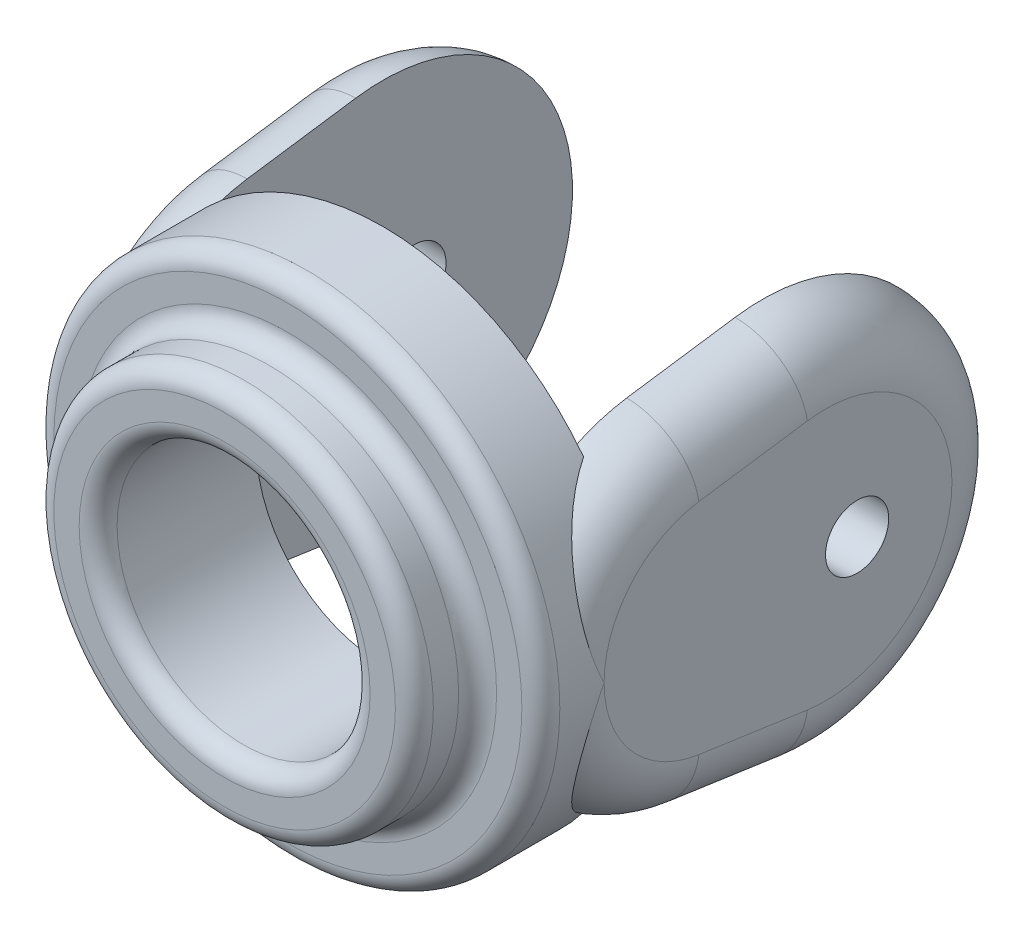
from build123d import *

# Parameters (mm, degrees)
EXTRUDE_1_DEPTH          = 10
EXTRUDE_1_DEPTH_BACK     = 5
SKETCH_1_R               = 40
SKETCH_2_R               = 30
EXTRUDE_2_DEPTH          = 10
SKETCH_3_R               = 20
CUT_EXTRUDE_1_DEPTH      = 62.846584384
EXTRUDE_3_DEPTH          = 10
EXTRUDE_START            = 10
EXTRUDE_4_DEPTH          = 10
CUT_EXTRUDE_2_DEPTH      = 111.566722046
CUT_EXTRUDE_2_DEPTH_BACK = 111.566722046
SKETCH_8_R               = 5
FILLET_1_R               = 10
FILLET_2_R               = 10
FILLET_3_R               = 3
FILLET_4_R               = 3


with BuildPart() as part:
    # 스케치1 → 보스-돌출1 (new, two sides: drawn at the far end of the back side and taken through both)
    with BuildSketch(Plane.XY.offset(-EXTRUDE_1_DEPTH_BACK)):
        Circle(SKETCH_1_R)
    extrude(amount=EXTRUDE_1_DEPTH + EXTRUDE_1_DEPTH_BACK)

    # 스케치2 → 보스-돌출2 (add)
    with BuildSketch(Plane.XY.offset(10)):
        Circle(SKETCH_2_R)
    extrude(amount=EXTRUDE_2_DEPTH)

    # 스케치3 → 컷-돌출1 (cut, through all)
    with BuildSketch(Plane.XY.offset(20)):
        Circle(SKETCH_3_R)
    extrude(amount=-CUT_EXTRUDE_1_DEPTH, mode=Mode.SUBTRACT)

    # 스케치6 → 보스-돌출3 (add)
    with BuildSketch(Plane(origin=(40, 0, 0), x_dir=(0, 0, -1), z_dir=(1, 0, 0))):
        with BuildLine():
            Line((13.571428571, 27.217941262), (30.714285714, 29.692299558))
            ThreePointArc((30.714285714, 29.692299558), (65, 0), (30.714285714, -29.692299558))
            Line((30.714285714, -29.692299558), (13.571428571, -27.217941262))
            ThreePointArc((13.571428571, -27.217941262), (-10, 0), (13.571428571, 27.217941262))
        make_face()
    extrude(amount=-EXTRUDE_3_DEPTH)

    # 스케치7 → 보스-돌출4 (add)
    with BuildSketch(Plane(origin=(-40, 0, 0), x_dir=(0, 0, -1), z_dir=(1, 0, 0)).offset(EXTRUDE_START)):
        with BuildLine():
            Line((30.714285714, 29.692299558), (13.571428571, 27.217941262))
            ThreePointArc((13.571428571, 27.217941262), (-10, 0), (13.571428571, -27.217941262))
            Line((13.571428571, -27.217941262), (30.714285714, -29.692299558))
            ThreePointArc((30.714285714, -29.692299558), (65, 0), (30.714285714, 29.692299558))
        make_face()
    extrude(amount=-EXTRUDE_4_DEPTH)

    # 스케치8 → 컷-돌출2 (cut, two sides: drawn at the far end of the back side and taken through both)
    with BuildSketch(Plane(origin=(-40, 0, 0), x_dir=(0, 0, -1), z_dir=(1, 0, 0)).offset(-CUT_EXTRUDE_2_DEPTH_BACK)):
        with Locations((40, 0)):
            Circle(SKETCH_8_R)
    extrude(amount=CUT_EXTRUDE_2_DEPTH + CUT_EXTRUDE_2_DEPTH_BACK, mode=Mode.SUBTRACT)

    # 필렛1
    # the kernel refuses this fillet: 10 mm, written as the material it takes off along each edge
    with BuildSketch(Plane(origin=(40, 0, -35), x_dir=(0, 0.989743318610787, 0.14285714285714288), z_dir=(0, -0.14285714285714288, 0.989743318610787))) as fillet_1_piece_1:
        with BuildLine():
            CenterArc((30 - FILLET_1_R, FILLET_1_R), FILLET_1_R, 270, 90)
            Line((30, FILLET_1_R), (30, 0))
            Line((30, 0), (30 - FILLET_1_R, 0))
        make_face()
    revolve(axis=Axis((40, 0, -35), (-1, 0, 0)), revolution_arc=196.426421403, mode=Mode.SUBTRACT)
    with BuildSketch(Plane(origin=(40, 27.217941262, -13.571428571), x_dir=(0, -0.9897433186107871, -0.1428571428571427), z_dir=(0, 0.1428571428571427, -0.9897433186107871)), Plane(origin=(40, -29.692299558, -30.714285714), x_dir=(0, 0.9897433186107871, -0.1428571428571427), z_dir=(0, 0.1428571428571427, 0.9897433186107871))) as fillet_1_piece_2:
        with BuildLine():
            CenterArc((FILLET_1_R, FILLET_1_R), FILLET_1_R, 180, 90)
            Line((0, FILLET_1_R), (0, 0))
            Line((0, 0), (FILLET_1_R, 0))
        make_face()
    extrude(amount=17.320508076, mode=Mode.SUBTRACT)
    with BuildSketch(Plane(origin=(40, 0, -17.5), x_dir=(0, -0.9897433186107871, 0.14285714285714243), z_dir=(0, -0.14285714285714243, -0.9897433186107871))) as fillet_1_piece_3_section:
        with BuildLine():
            CenterArc((27.5 - FILLET_1_R, FILLET_1_R), FILLET_1_R, 270, 90)
            Line((27.5 - FILLET_1_R, 0), (27.5, 0))
            Line((27.5, 0), (27.5, FILLET_1_R))
        make_face()
    fillet_1_piece_3 = revolve(axis=Axis((40, 0, -17.5), (-1, 0, 0)), revolution_arc=81.786789298, mode=Mode.PRIVATE)
    fillet_1_piece_3 = split(fillet_1_piece_3, bisect_by=Plane(origin=(37.813701487, -23.668076626, -5), z_dir=(0, 0, -1)), keep=Keep.TOP, mode=Mode.PRIVATE)
    add(fillet_1_piece_3, mode=Mode.SUBTRACT)
    with BuildSketch(Plane(origin=(40, 0, -17.5), x_dir=(0, -0.9897433186107871, 0.14285714285714243), z_dir=(0, -0.14285714285714243, -0.9897433186107871))) as fillet_1_piece_4_section:
        with BuildLine():
            CenterArc((27.5 - FILLET_1_R, FILLET_1_R), FILLET_1_R, 270, 90)
            Line((27.5 - FILLET_1_R, 0), (27.5, 0))
            Line((27.5, 0), (27.5, FILLET_1_R))
        make_face()
    fillet_1_piece_4 = revolve(axis=Axis((40, 0, -17.5), (-1, 0, 0)), revolution_arc=81.786789298, mode=Mode.PRIVATE)
    fillet_1_piece_4 = fillet_1_piece_4 - Plane(origin=(0, 0, 0.682031715), x_dir=(1, 0, 0), z_dir=(0, 0, -1)) * Cylinder(40, 110, mode=Mode.PRIVATE)
    add(fillet_1_piece_4, mode=Mode.SUBTRACT)
    with BuildSketch(Plane(origin=(40, 0, -17.5), x_dir=(0, 0, 1), z_dir=(0, -1, 0))) as fillet_1_piece_5_section:
        with BuildLine():
            CenterArc((27.5 - FILLET_1_R, FILLET_1_R), FILLET_1_R, 270, 90)
            Line((27.5, FILLET_1_R), (27.5, 0))
            Line((27.5, 0), (27.5 - FILLET_1_R, 0))
        make_face()
    fillet_1_piece_5 = revolve(axis=Axis((40, 0, -17.5), (-1, 0, 0)), revolution_arc=81.786789298, mode=Mode.PRIVATE)
    fillet_1_piece_5 = fillet_1_piece_5 - Plane(origin=(0, 0, 0.682032438), x_dir=(1, 0, 0), z_dir=(0, 0, -1)) * Cylinder(40, 111, mode=Mode.PRIVATE)
    add(fillet_1_piece_5, mode=Mode.SUBTRACT)
    with BuildSketch(Plane(origin=(40, 0, -17.5), x_dir=(0, 0, 1), z_dir=(0, -1, 0))) as fillet_1_piece_6_section:
        with BuildLine():
            CenterArc((27.5 - FILLET_1_R, FILLET_1_R), FILLET_1_R, 270, 90)
            Line((27.5, FILLET_1_R), (27.5, 0))
            Line((27.5, 0), (27.5 - FILLET_1_R, 0))
        make_face()
    fillet_1_piece_6 = revolve(axis=Axis((40, 0, -17.5), (-1, 0, 0)), revolution_arc=81.786789298, mode=Mode.PRIVATE)
    fillet_1_piece_6 = split(fillet_1_piece_6, bisect_by=Plane(origin=(31.001684961, 24.879661093, -5), z_dir=(0, 0, -1)), keep=Keep.TOP, mode=Mode.PRIVATE)
    add(fillet_1_piece_6, mode=Mode.SUBTRACT)

    # 필렛2
    # the kernel refuses this fillet: 10 mm, written as the material it takes off along each edge
    with BuildSketch(Plane(origin=(-40, 0, -17.5), x_dir=(0, -2.2670264695792934e-09, 1.0), z_dir=(0, 1.0, 2.2670264695792934e-09))) as fillet_2_piece_1_section:
        with BuildLine():
            CenterArc((27.5 - FILLET_2_R, FILLET_2_R), FILLET_2_R, 270, 90)
            Line((27.5 - FILLET_2_R, 0), (27.5, 0))
            Line((27.5, 0), (27.5, FILLET_2_R))
        make_face()
    fillet_2_piece_1 = revolve(axis=Axis((-40, 0, -17.5), (1, 0, 0)), revolution_arc=81.786789168, mode=Mode.PRIVATE)
    fillet_2_piece_1 = fillet_2_piece_1 - Plane(origin=(0, 0, 0.682033406), x_dir=(1, 0, 0), z_dir=(0, 0, -1)) * Cylinder(40, 111, mode=Mode.PRIVATE)
    add(fillet_2_piece_1, mode=Mode.SUBTRACT)
    with BuildSketch(Plane(origin=(-40, 0, -17.5), x_dir=(0, -2.2670264695792934e-09, 1.0), z_dir=(0, 1.0, 2.2670264695792934e-09))) as fillet_2_piece_2_section:
        with BuildLine():
            CenterArc((27.5 - FILLET_2_R, FILLET_2_R), FILLET_2_R, 270, 90)
            Line((27.5 - FILLET_2_R, 0), (27.5, 0))
            Line((27.5, 0), (27.5, FILLET_2_R))
        make_face()
    fillet_2_piece_2 = revolve(axis=Axis((-40, 0, -17.5), (1, 0, 0)), revolution_arc=81.786789168, mode=Mode.PRIVATE)
    fillet_2_piece_2 = split(fillet_2_piece_2, bisect_by=Plane(origin=(-31.001684959, -24.879661102, -5), z_dir=(0, 0, -1)), keep=Keep.TOP, mode=Mode.PRIVATE)
    add(fillet_2_piece_2, mode=Mode.SUBTRACT)
    with BuildSketch(Plane(origin=(-40, -27.217941262, -13.571428571), x_dir=(1, 0, 0), z_dir=(0, -0.1428571428571422, -0.9897433186107871)), Plane(origin=(-40, 29.692299558, -30.714285714), x_dir=(1, 0, 0), z_dir=(0, -0.1428571428571422, 0.9897433186107871))) as fillet_2_piece_3:
        with BuildLine():
            CenterArc((FILLET_2_R, -FILLET_2_R), FILLET_2_R, 90, 90)
            Line((0, -FILLET_2_R), (0, 0))
            Line((0, 0), (FILLET_2_R, 0))
        make_face()
    extrude(amount=17.320508076, mode=Mode.SUBTRACT)
    with BuildSketch(Plane(origin=(-40, 0, -35), x_dir=(0, -0.9897433186107871, 0.14285714285714157), z_dir=(0, 0.14285714285714157, 0.9897433186107871))) as fillet_2_piece_4:
        with BuildLine():
            CenterArc((30 - FILLET_2_R, FILLET_2_R), FILLET_2_R, 270, 90)
            Line((30 - FILLET_2_R, 0), (30, 0))
            Line((30, 0), (30, FILLET_2_R))
        make_face()
    revolve(axis=Axis((-40, 0, -35), (1, 0, 0)), revolution_arc=196.426421403, mode=Mode.SUBTRACT)
    with BuildSketch(Plane(origin=(-40, 0, -17.5), x_dir=(0, 0.9897433186107871, 0.14285714285714218), z_dir=(0, 0.14285714285714218, -0.9897433186107871))) as fillet_2_piece_5_section:
        with BuildLine():
            CenterArc((27.5 - FILLET_2_R, FILLET_2_R), FILLET_2_R, 270, 90)
            Line((27.5 - FILLET_2_R, 0), (27.5, 0))
            Line((27.5, 0), (27.5, FILLET_2_R))
        make_face()
    fillet_2_piece_5 = revolve(axis=Axis((-40, 0, -17.5), (1, 0, 0)), revolution_arc=81.786789428, mode=Mode.PRIVATE)
    fillet_2_piece_5 = split(fillet_2_piece_5, bisect_by=Plane(origin=(-37.813701921, 23.668076798, -5), z_dir=(0, 0, -1)), keep=Keep.TOP, mode=Mode.PRIVATE)
    add(fillet_2_piece_5, mode=Mode.SUBTRACT)
    with BuildSketch(Plane(origin=(-40, 0, -17.5), x_dir=(0, 0.9897433186107871, 0.14285714285714218), z_dir=(0, 0.14285714285714218, -0.9897433186107871))) as fillet_2_piece_6_section:
        with BuildLine():
            CenterArc((27.5 - FILLET_2_R, FILLET_2_R), FILLET_2_R, 270, 90)
            Line((27.5 - FILLET_2_R, 0), (27.5, 0))
            Line((27.5, 0), (27.5, FILLET_2_R))
        make_face()
    fillet_2_piece_6 = revolve(axis=Axis((-40, 0, -17.5), (1, 0, 0)), revolution_arc=81.786789428, mode=Mode.PRIVATE)
    fillet_2_piece_6 = fillet_2_piece_6 - Plane(origin=(0, 0, 0.682032284), x_dir=(1, 0, 0), z_dir=(0, 0, -1)) * Cylinder(40, 111, mode=Mode.PRIVATE)
    add(fillet_2_piece_6, mode=Mode.SUBTRACT)

    # 필렛3
    # the kernel refuses this fillet: 3 mm, written as the material it adds along each edge
    with BuildSketch(Plane(origin=(0, 0, 10), x_dir=(1, 0, 0), z_dir=(0, 1, 0))) as fillet_3_piece_1:
        with BuildLine():
            CenterArc((30 + FILLET_3_R, -FILLET_3_R), FILLET_3_R, 90, 90)
            Line((30, -FILLET_3_R), (30, 0))
            Line((30, 0), (30 + FILLET_3_R, 0))
        make_face()
    revolve(axis=Axis((0, 0, 10), (0, 0, -1)))
    # the kernel refuses this fillet: 3 mm, written as the material it takes off along each edge
    with BuildSketch(Plane(origin=(0, 0, 10), x_dir=(-1.0, -1.558580697495618e-09, 0), z_dir=(-1.558580697495618e-09, 1.0, 0))) as fillet_3_2_piece_1:
        with BuildLine():
            CenterArc((40 - FILLET_3_R, -FILLET_3_R), FILLET_3_R, 0, 90)
            Line((40 - FILLET_3_R, 0), (40, 0))
            Line((40, 0), (40, -FILLET_3_R))
        make_face()
    revolve(axis=Axis((0, 0, 10), (0, 0, 1)), revolution_arc=179.999999911, mode=Mode.SUBTRACT)
    with BuildSketch(Plane(origin=(0, 0, 10), x_dir=(1, 0, 0), z_dir=(0, -1, 0))) as fillet_3_2_piece_2:
        with BuildLine():
            CenterArc((40 - FILLET_3_R, -FILLET_3_R), FILLET_3_R, 0, 90)
            Line((40, -FILLET_3_R), (40, 0))
            Line((40, 0), (40 - FILLET_3_R, 0))
        make_face()
    revolve(axis=Axis((0, 0, 10), (0, 0, 1)), revolution_arc=180.000000089, mode=Mode.SUBTRACT)

    # 필렛4
    fillet_4_edges = [part.edges().sort_by_distance(p)[0] for p in [
        (-20, 0, 20),
        (-30, 0, 20),
    ]]
    fillet(fillet_4_edges, radius=FILLET_4_R)


solid = part.part
